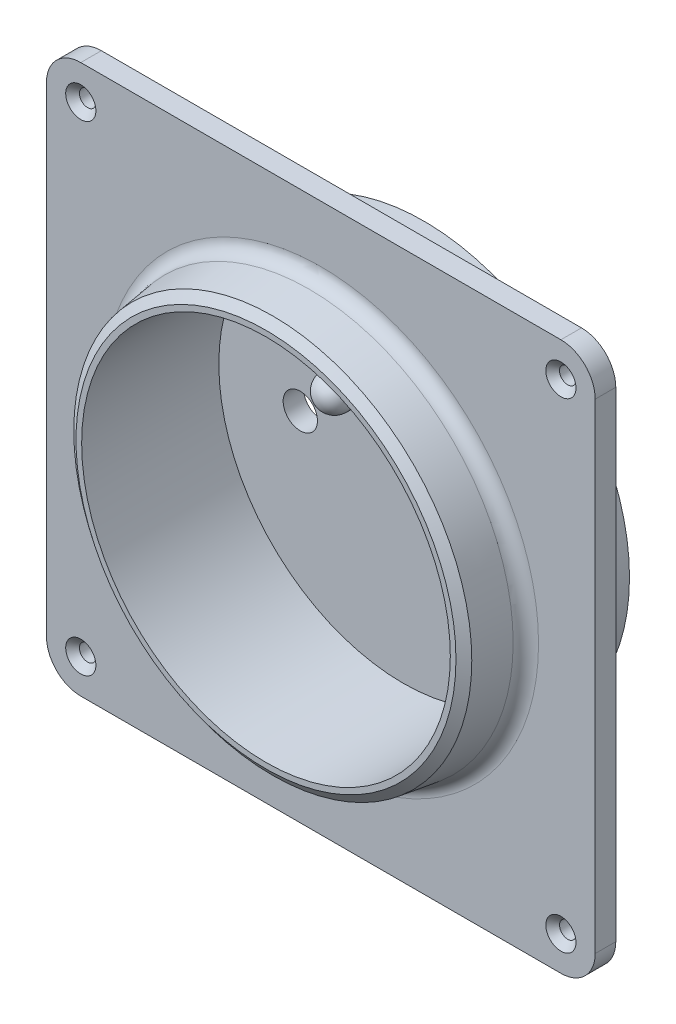
from build123d import *

# Parameters (mm, degrees)
PROFIL_BASE_W                                  = 80
PROFIL_BASE_H                                  = 80
BOSS_EXTRU_1_DEPTH                             = 1.5
CONG_1_R                                       = 5
ESQUISSE2_R                                    = 30
BOSS_EXTRU_2_DEPTH                             = 8
BOSS_EXTRU_2_TAPER                             = 8
BOSS_EXTRU_2_OTHER_WAY_DEPTH                   = 15
ESQUISSE4_R                                    = 26.875673322
ENL_V_MAT_EXTRU_1_DEPTH                        = 20
DIAM_TRE_DU_PER_AGE_0_15_5_1_D                 = 5
ESQUISSE8_R                                    = 2.5
BOSS_EXTRU_3_DEPTH                             = 10
R_VOLUTION1_ANGLE                              = 180
CHANFREIN1_SIZE                                = 1
CHANFREIN1_SIZE_2                              = 1.174957012
CONG_2_R                                       = 2
FRAISAGE_POUR_VIS_T_TE_FRAIS_E_M21_D           = 2.4
FRAISAGE_POUR_VIS_T_TE_FRAIS_E_M21_CSINK_D     = 4.4
FRAISAGE_POUR_VIS_T_TE_FRAIS_E_M21_CSINK_ANGLE = 90


with BuildPart() as part:
    # Profil Base → Boss.-Extru.1 (new, symmetric)
    with BuildSketch(Plane.XY):
        Rectangle(PROFIL_BASE_W, PROFIL_BASE_H)
    extrude(amount=BOSS_EXTRU_1_DEPTH, both=True)

    # Congé1
    cong_1_edges = [part.edges().sort_by_distance(p)[0] for p in [
        (40, -40, 0),
        (-40, -40, 0),
        (-40, 40, 0),
        (40, 40, 0),
    ]]
    fillet(cong_1_edges, radius=CONG_1_R)

    # Esquisse2 → Boss.-Extru.2 (add)
    with BuildSketch(Plane.XY.offset(1.5)):
        Circle(ESQUISSE2_R)
    extrude(amount=BOSS_EXTRU_2_DEPTH, taper=BOSS_EXTRU_2_TAPER)

    # Esquisse2 → Boss.-Extru.2 other way (add)
    with BuildSketch(Plane.XY.offset(1.5)):
        Circle(ESQUISSE2_R)
    extrude(amount=-BOSS_EXTRU_2_OTHER_WAY_DEPTH)

    # Esquisse4 → Enlèv. mat.-Extru.1 (cut)
    with BuildSketch(Plane.XY.offset(9.5)):
        Circle(ESQUISSE4_R)
    extrude(amount=-ENL_V_MAT_EXTRU_1_DEPTH, mode=Mode.SUBTRACT)

    # Diamètre du perçage Ø0.15 (5)1 (through all)
    with Locations(Plane.XY.offset(-10.5)):
        with Locations((-15, 0), (15, 0)):
            Hole(DIAM_TRE_DU_PER_AGE_0_15_5_1_D / 2)

    # Esquisse8 → Boss.-Extru.3 (add)
    with BuildSketch(Plane.XY.offset(-10.5)):
        with Locations((0, 15)):
            Circle(ESQUISSE8_R)
    extrude(amount=BOSS_EXTRU_3_DEPTH)

    # Esquisse9 → Révolution1 (revolve)
    with BuildSketch(Plane.XY.offset(-0.5)):
        with BuildLine():
            Line((0, 17.5), (0, 12.5))
            ThreePointArc((0, 12.5), (2.5, 15), (0, 17.5))
        make_face()
    revolve(axis=Axis((0, 17.5, -0.5), (0, -1, 0)), revolution_arc=R_VOLUTION1_ANGLE)

    # Chanfrein1
    # the kernel refuses this chamfer: 1.174957012, 1 mm, written as the material it takes off along each edge
    with BuildSketch(Plane(origin=(0, 0, 9.5), x_dir=(1, 0, 0), z_dir=(0, 1, 0))) as chanfrein1_piece_1:
        Polygon((28.875673322 + CHANFREIN1_SIZE * 0.13917310096, CHANFREIN1_SIZE * 0.990268068742), (28.875673322 - CHANFREIN1_SIZE_2, 0), (28.875673322, 0), align=None)
    revolve(axis=Axis((0, 0, 9.5), (0, 0, -1)), mode=Mode.SUBTRACT)

    # Congé2
    cong_2_edges = [part.edges().sort_by_distance(p)[0] for p in [
        (-30, 0, -1.5),
        (-30, 0, 1.5),
    ]]
    fillet(cong_2_edges, radius=CONG_2_R)

    # Fraisage pour vis à tête fraisée M21 (through all)
    with Locations(Plane.XY.offset(1.5)):
        with Locations((-35, 35), (35, 35), (-35, -35), (35, -35)):
            CounterSinkHole(FRAISAGE_POUR_VIS_T_TE_FRAIS_E_M21_D / 2, FRAISAGE_POUR_VIS_T_TE_FRAIS_E_M21_CSINK_D / 2, counter_sink_angle=FRAISAGE_POUR_VIS_T_TE_FRAIS_E_M21_CSINK_ANGLE)


solid = part.part
